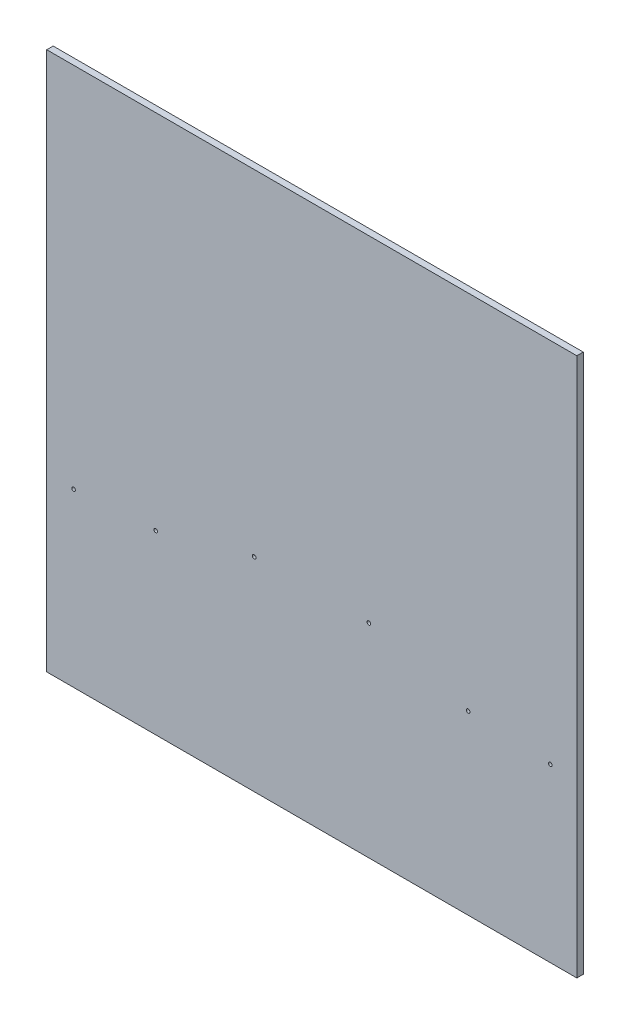
from build123d import *

# Parameters (mm, degrees)
BOSS_EXTRUDE1_DEPTH                              = 11.90625
CSK_FOR_1_4_FLAT_HEAD_MACHINE_SCREW1_D           = 6.7564
CSK_FOR_1_4_FLAT_HEAD_MACHINE_SCREW1_CSINK_D     = 12.8778
CSK_FOR_1_4_FLAT_HEAD_MACHINE_SCREW1_CSINK_ANGLE = 82


with BuildPart() as part:
    # Sketch1 → Boss-Extrude1 (new body)
    with BuildSketch(Plane.XY):
        Polygon((-232.000354679, 467.659403596), (751.233645321, 467.659403596), (751.233645321, -529.290596404), (751.233645321, -531.830596404), (-232.000354679, -531.830596404), (-232.000354679, -529.290596404), align=None)
    extrude(amount=BOSS_EXTRUDE1_DEPTH)

    # CSK for 1/4 Flat Head Machine Screw1 (through all)
    with Locations(Plane(origin=(702.021145321, -213.297333827, 0), x_dir=(-1, 0, 0), z_dir=(0, 0, -1))):
        with Locations((0, 0), (152.4, 9.525), (336.55, 58.7375), (549.275, 58.7375), (731.8375, 9.525), (884.2375, 0)):
            CounterSinkHole(CSK_FOR_1_4_FLAT_HEAD_MACHINE_SCREW1_D / 2, CSK_FOR_1_4_FLAT_HEAD_MACHINE_SCREW1_CSINK_D / 2, counter_sink_angle=CSK_FOR_1_4_FLAT_HEAD_MACHINE_SCREW1_CSINK_ANGLE)


solid = part.part
